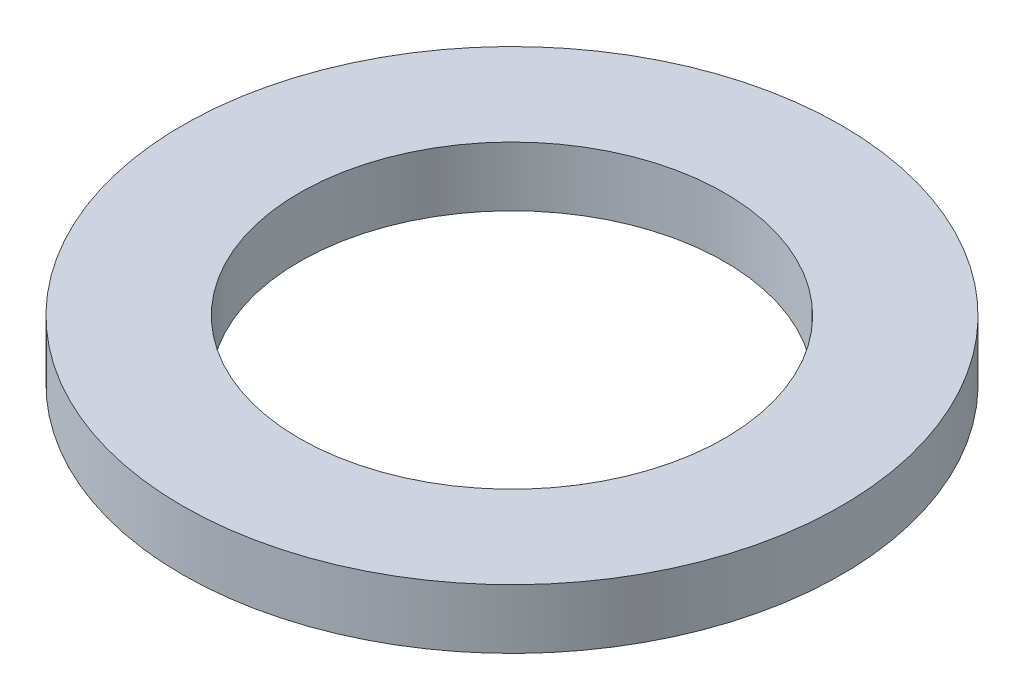
from build123d import *

# Parameters (mm, degrees)
SKETCH1_R           = 77.5
BOSS_EXTRUDE1_DEPTH = 14
SKETCH2_R           = 50
CUT_EXTRUDE1_DEPTH  = 111.492081164


with BuildPart() as part:
    # Sketch1 → Boss-Extrude1 (new body)
    with BuildSketch(Plane(origin=(0, 0, 0), x_dir=(1, 0, 0), z_dir=(0, 1, 0))):
        Circle(SKETCH1_R)
    extrude(amount=BOSS_EXTRUDE1_DEPTH)

    # Sketch2 → Cut-Extrude1 (cut, through all)
    with BuildSketch(Plane(origin=(0, 0, 0), x_dir=(1, 0, 0), z_dir=(0, 1, 0))):
        Circle(SKETCH2_R)
    extrude(amount=CUT_EXTRUDE1_DEPTH, mode=Mode.SUBTRACT)


solid = part.part
